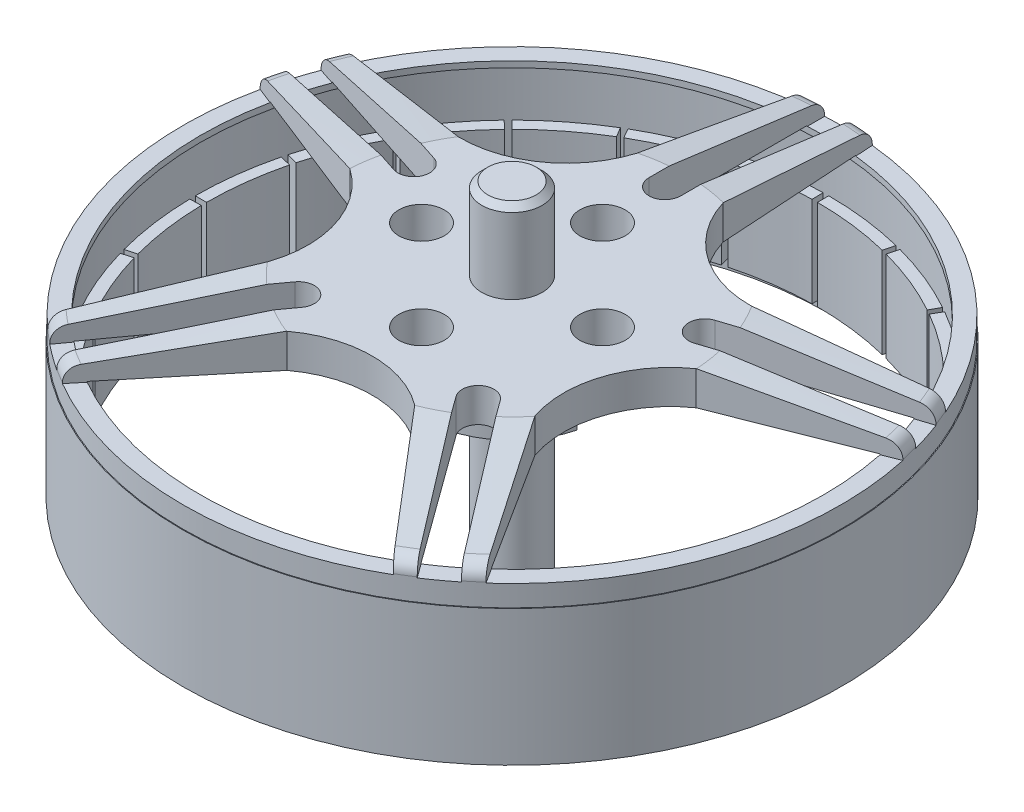
from build123d import *

# Parameters (mm, degrees)
SKETCH1_R           = 21.8
BOSS_EXTRUDE1_DEPTH = 12.7
SKETCH2_R           = 20.65
CUT_EXTRUDE1_DEPTH  = 10.45
SKETCH5_R           = 6
BOSS_EXTRUDE2_DEPTH = 3
SKETCH6_R           = 1.5
CUT_EXTRUDE2_DEPTH  = 10
CUT_EXTRUDE3_DEPTH  = 2.3
CIRPATTERN1_COUNT   = 5
CUT_EXTRUDE4_DEPTH  = 2.3
CIRPATTERN2_COUNT   = 5
SKETCH10_R          = 21
SKETCH10_R_2        = 7.812812073
CUT_EXTRUDE5_DEPTH  = 10
SKETCH11_R          = 2
CUT_EXTRUDE6_DEPTH  = 10
SKETCH12_R          = 2
BOSS_EXTRUDE3_DEPTH = 25.48
CHAMFER1_SIZE       = 0.4
SKETCH13_R          = 21.85
SKETCH13_R_2        = 21.8
BOSS_EXTRUDE4_DEPTH = 9
BOSS_EXTRUDE5_DEPTH = 6
CIRPATTERN3_COUNT   = 24
SKETCH15_R          = 2.586396607
SKETCH15_R_2        = 1.75
CUT_EXTRUDE7_DEPTH  = 0.3


with BuildPart() as part:
    # Sketch1 → Boss-Extrude1 (new body)
    with BuildSketch(Plane(origin=(0, 0, 0), x_dir=(1, 0, 0), z_dir=(0, 1, 0))):
        with Locations(Location((0, 0, 0), (0, 0, 270))):
            Circle(SKETCH1_R)
    extrude(amount=BOSS_EXTRUDE1_DEPTH)

    # Sketch2 → Cut-Extrude1 (cut)
    with BuildSketch(Plane.XZ):
        with Locations(Location((0, 0, 0), (0, 0, 270))):
            Circle(SKETCH2_R)
    extrude(amount=-CUT_EXTRUDE1_DEPTH, mode=Mode.SUBTRACT)

    # Sketch3 → Cut-Revolve1 (revolve, cut)
    with BuildSketch(Plane.XY, mode=Mode.PRIVATE) as cut_revolve1_sk:
        with BuildLine():
            Line((20.931657049, 11.450008234), (11.52, 12.7))
            Line((11.52, 12.7), (21.8, 12.7))
            Line((21.8, 12.7), (21.8, 10.458712909))
            ThreePointArc((21.8, 10.458712909), (21.552215743, 11.117629804), (20.931657049, 11.450008234))
        make_face()
    revolve(cut_revolve1_sk.sketch.rotate(Axis((0, 12.7, 0), (0, 1, 0)), 90), axis=Axis((0, 12.7, 0), (0, 1, 0)), mode=Mode.SUBTRACT)

    # Sketch5 → Boss-Extrude2 (add)
    with BuildSketch(Plane.XZ.offset(-10.45)):
        with Locations(Location((0, 0, 0), (0, 0, 270))):
            Circle(SKETCH5_R)
    extrude(amount=BOSS_EXTRUDE2_DEPTH)

    # Sketch6 → Cut-Extrude2 (cut)
    with BuildSketch(Plane(origin=(0, 12.7, 0), x_dir=(1, 0, 0), z_dir=(0, 1, 0))):
        with Locations(Location((-6, 0, 0), (0, 0, 270))):
            Circle(SKETCH6_R)
        with Locations(Location((0, 6, 0), (0, 0, 270))):
            Circle(SKETCH6_R)
        with Locations(Location((6, 0, 0), (0, 0, 270))):
            Circle(SKETCH6_R)
        with Locations(Location((0, -6, 0), (0, 0, 270))):
            Circle(SKETCH6_R)
    extrude(amount=-CUT_EXTRUDE2_DEPTH, mode=Mode.SUBTRACT)

    # Sketch8 → Cut-Extrude3 (cut)
    with BuildSketch(Plane(origin=(0, 12.7, 0), x_dir=(1, 0, 0), z_dir=(0, 1, 0))):
        with BuildLine():
            Line((-1.05, 22.748404699), (-1.05, 10.1376836))
            ThreePointArc((-1.05, 10.1376836), (0, 9.0876836), (1.05, 10.1376836))
            Line((1.05, 10.1376836), (1.05, 22.748404699))
            Line((1.05, 22.748404699), (-1.05, 22.748404699))
        make_face()
    cut_extrude3 = extrude(amount=-CUT_EXTRUDE3_DEPTH, mode=Mode.SUBTRACT)

    # CirPattern1: Cut-Extrude3 ×5 about axis
    cirpattern1_axis = Axis((0, 0, 0), (0, 1, 0))
    for i in range(1, CIRPATTERN1_COUNT):
        add(cut_extrude3.rotate(cirpattern1_axis, i * 360 / CIRPATTERN1_COUNT), mode=Mode.SUBTRACT)

    # Sketch9 → Cut-Extrude4 (cut)
    with BuildSketch(Plane(origin=(0, 12.7, 0), x_dir=(1, 0, 0), z_dir=(0, 1, 0))):
        with BuildLine():
            Line((13.056756632, -21.368544153), (4.241400764, -10.690426))
            ThreePointArc((4.241400764, -10.690426), (0, -9.277892513), (-4.241400764, -10.690426))
            Line((-4.241400764, -10.690426), (-13.056756632, -21.368544153))
            Line((-13.056756632, -21.368544153), (0, -23.078356502))
            Line((0, -23.078356502), (13.056756632, -21.368544153))
        make_face()
    cut_extrude4 = extrude(amount=-CUT_EXTRUDE4_DEPTH, mode=Mode.SUBTRACT)

    # CirPattern2: Cut-Extrude4 ×5 about axis
    cirpattern2_axis = Axis((0, 0, 0), (0, 1, 0))
    for i in range(1, CIRPATTERN2_COUNT):
        add(cut_extrude4.rotate(cirpattern2_axis, i * 360 / CIRPATTERN2_COUNT), mode=Mode.SUBTRACT)

    # Sketch10 → Cut-Extrude5 (cut)
    with BuildSketch(Plane.XZ):
        with Locations(Location((0, 0, 0), (0, 0, 270))):
            Circle(SKETCH10_R)
        Circle(SKETCH10_R_2, mode=Mode.SUBTRACT)
    extrude(amount=-CUT_EXTRUDE5_DEPTH, mode=Mode.SUBTRACT)

    # Sketch11 → Cut-Extrude6 (cut)
    with BuildSketch(Plane(origin=(0, 12.7, 0), x_dir=(1, 0, 0), z_dir=(0, 1, 0))):
        with Locations(Location((0, 0, 0), (0, 0, 270))):
            Circle(SKETCH11_R)
    extrude(amount=-CUT_EXTRUDE6_DEPTH, mode=Mode.SUBTRACT)

    # Sketch12 → Boss-Extrude3 (add)
    with BuildSketch(Plane(origin=(0, 18.1, 0), x_dir=(1, 0, 0), z_dir=(0, 1, 0))):
        with Locations(Location((0, 0, 0), (0, 0, 270))):
            Circle(SKETCH12_R)
    boss_extrude3 = extrude(amount=-BOSS_EXTRUDE3_DEPTH)

    # Chamfer1
    chamfer1_edges = [part.edges().sort_by_distance(p)[0] for p in [
        (0, -7.38, -2),
        (0, 18.1, -2),
    ]]
    chamfer(chamfer1_edges, length=CHAMFER1_SIZE)

    # Sketch13 → Boss-Extrude4 (add)
    with BuildSketch(Plane.XZ):
        with Locations(Location((0, 0, 0), (0, 0, 270))):
            Circle(SKETCH13_R)
        with Locations(Location((0, 0, 0), (0, 0, 270))):
            Circle(SKETCH13_R_2, mode=Mode.SUBTRACT)
    extrude(amount=-BOSS_EXTRUDE4_DEPTH)

    # Sketch14 → Boss-Extrude5 (add)
    with BuildSketch(Plane.XZ.offset(-0.75)):
        with BuildLine():
            Line((-4.898918386, 19.648488457), (-5.080359808, 20.376210252))
            ThreePointArc((-5.080359808, 20.376210252), (-2.559256212, 20.843469184), (0, 21))
            Line((0, 21), (0, 20.25))
            ThreePointArc((0, 20.25), (-2.467854204, 20.099059571), (-4.898918386, 19.648488457))
        make_face()
    boss_extrude5 = extrude(amount=-BOSS_EXTRUDE5_DEPTH)

    # CirPattern3: Boss-Extrude3, Boss-Extrude5 ×24 about axis
    cirpattern3_axis = Axis((0, 0, 0), (0, 1, 0))
    add([boss_extrude3.rotate(cirpattern3_axis, i * 360 / CIRPATTERN3_COUNT) for i in range(1, CIRPATTERN3_COUNT)])
    add([boss_extrude5.rotate(cirpattern3_axis, i * 360 / CIRPATTERN3_COUNT) for i in range(1, CIRPATTERN3_COUNT)])

    # Chamfer2
    # the kernel refuses this chamfer: 0.4 mm, written as the material it takes off along each edge
    with BuildSketch(Plane(origin=(0, -7.38, 0), x_dir=(0.2588190451025206, 0, 0.9659258262890683), z_dir=(-0.9659258262890683, 0, 0.2588190451025206))) as chamfer2_piece_1:
        with BuildLine():
            Line((2.011313708, 0.411313708), (1.588686292, -0.011313708))
            Line((1.588686292, -0.011313708), (1.588686292, -0.019313708))
            ThreePointArc((1.588686292, -0.019313708), (1.794343146, -0.008), (2, -0.008))
            Line((2, -0.008), (2.008, 0))
            ThreePointArc((2.008, 0), (2.008, 0.205656854), (2.019313708, 0.411313708))
            Line((2.019313708, 0.411313708), (2.011313708, 0.411313708))
        make_face()
    revolve(axis=Axis((0, -7.38, 0), (0, 1, 0)), mode=Mode.SUBTRACT)
    with BuildSketch(Plane(origin=(0, 18.1, 0), x_dir=(0.25881904510252035, 0, 0.9659258262890685), z_dir=(0.9659258262890685, 0, -0.25881904510252035))) as chamfer2_piece_2:
        with BuildLine():
            Line((2.011313708, 0.411313708), (1.588686292, -0.011313708))
            Line((1.588686292, -0.011313708), (1.588686292, -0.019313708))
            ThreePointArc((1.588686292, -0.019313708), (1.794343146, -0.008), (2, -0.008))
            Line((2, -0.008), (2.008, 0))
            ThreePointArc((2.008, 0), (2.008, 0.205656854), (2.019313708, 0.411313708))
            Line((2.019313708, 0.411313708), (2.011313708, 0.411313708))
        make_face()
    revolve(axis=Axis((0, 18.1, 0), (0, -1, 0)), mode=Mode.SUBTRACT)

    # Sketch15 → Cut-Extrude7 (cut)
    with BuildSketch(Plane(origin=(0, -5.28, 0), x_dir=(-1, 0, 0), z_dir=(0, -1, 0))):
        Circle(SKETCH15_R)
        with Locations(Location((0, 0, 0), (0, 0, 90))):
            Circle(SKETCH15_R_2, mode=Mode.SUBTRACT)
    extrude(amount=CUT_EXTRUDE7_DEPTH, mode=Mode.SUBTRACT)


solid = part.part
